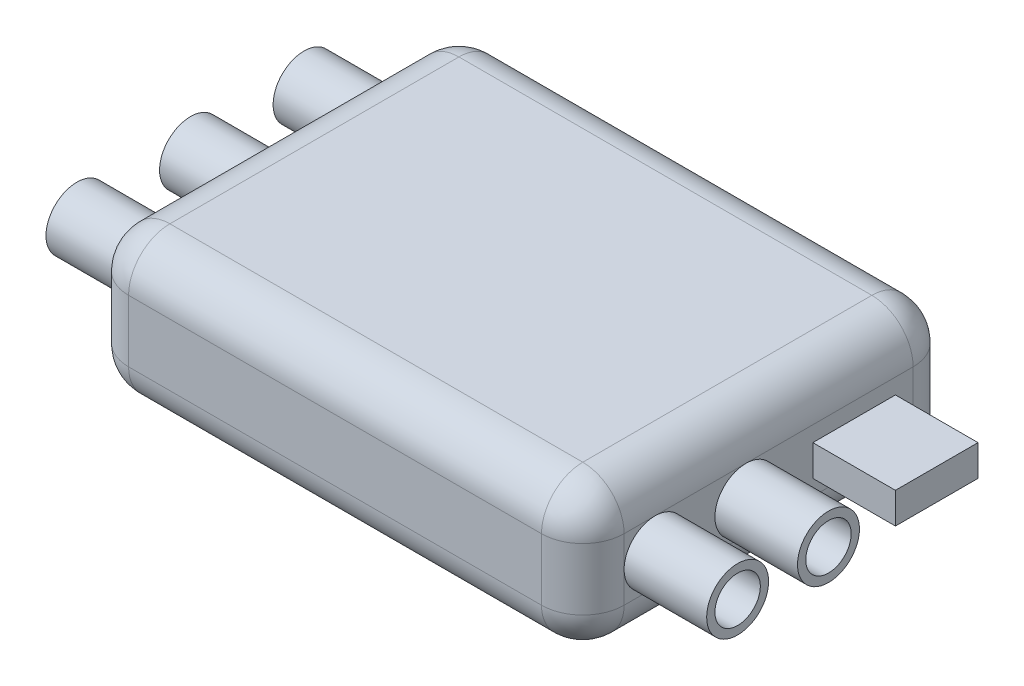
from build123d import *

# Parameters (mm, degrees)
BOSS_EXTRUDE1_DEPTH = 7
CUT_EXTRUDE3_DEPTH  = 27.570660511
SKETCH7_R           = 1.5
SKETCH7_R_2         = 1.1
BOSS_EXTRUDE3_DEPTH = 4
BOSS_EXTRUDE4_START = 4
SKETCH8_R           = 1.5
SKETCH8_R_2         = 1.1
SKETCH8_W           = 4
SKETCH8_H           = 1.5
BOSS_EXTRUDE4_DEPTH = 4
FILLET1_R           = 2


with BuildPart() as part:
    # Sketch1 → Boss-Extrude1 (new body)
    with BuildSketch(Plane(origin=(0, 0, 0), x_dir=(1, 0, 0), z_dir=(0, 1, 0))):
        with BuildLine():
            Line((10, -9), (-10, -9))
            ThreePointArc((-10, -9), (-11.414213562, -8.414213562), (-12, -7))
            Line((-12, -7), (-12, 7))
            ThreePointArc((-12, 7), (-11.414213562, 8.414213562), (-10, 9))
            Line((-10, 9), (10, 9))
            ThreePointArc((10, 9), (11.414213562, 8.414213562), (12, 7))
            Line((12, 7), (12, -7))
            ThreePointArc((12, -7), (11.414213562, -8.414213562), (10, -9))
        make_face()
    extrude(amount=-BOSS_EXTRUDE1_DEPTH)

    # Sketch5 → Cut-Extrude3 (cut, through all)
    with BuildSketch(Plane.ZY.offset(12)):
        with BuildLine():
            ThreePointArc((-7, 0), (-8.414213562, -0.585786438), (-9, -2))
            Line((-9, -2), (-9, 0))
            Line((-9, 0), (-7, 0))
        make_face()
        with BuildLine():
            ThreePointArc((-9, -5), (-8.414213562, -6.414213562), (-7, -7))
            Line((-7, -7), (-9, -7))
            Line((-9, -7), (-9, -5))
        make_face()
        with BuildLine():
            ThreePointArc((7, -7), (8.414213562, -6.414213562), (9, -5))
            Line((9, -5), (9, -7))
            Line((9, -7), (7, -7))
        make_face()
        with BuildLine():
            Line((7, 0), (9, 0))
            Line((9, 0), (9, -2))
            ThreePointArc((9, -2), (8.414213562, -0.585786438), (7, 0))
        make_face()
    extrude(amount=-CUT_EXTRUDE3_DEPTH, mode=Mode.SUBTRACT)

    # Sketch7 → Boss-Extrude3 (add)
    # profile 1 of 3: a face of its own
    with BuildSketch(Plane.ZY.offset(12)):
        with Locations(Location((-5.5, -3.5, 0), (0, 0, 180))):
            Circle(SKETCH7_R)
        with Locations((-5.5, -3.5)):
            Circle(SKETCH7_R_2, mode=Mode.SUBTRACT)
    # profile 2 of 3: a face of its own
    with BuildSketch(Plane.ZY.offset(12)):
        with Locations((0, -3.5)):
            Circle(SKETCH7_R)
        with Locations((0, -3.5)):
            Circle(SKETCH7_R_2, mode=Mode.SUBTRACT)
    # profile 3 of 3: a face of its own
    with BuildSketch(Plane.ZY.offset(12)):
        with Locations((5.5, -3.5)):
            Circle(SKETCH7_R)
        with Locations((5.5, -3.5)):
            Circle(SKETCH7_R_2, mode=Mode.SUBTRACT)
    extrude(amount=BOSS_EXTRUDE3_DEPTH)

    # Sketch8 → Boss-Extrude4 (add)
    # profile 1 of 3: a face of its own
    with BuildSketch(Plane(origin=(12, 0, 0), x_dir=(0, 0, -1), z_dir=(1, 0, 0)).offset(BOSS_EXTRUDE4_START)):
        with Locations(Location((-5.5, -3.5, 0), (0, 0, 180))):
            Circle(SKETCH8_R)
        with Locations(Location((-5.5, -3.5, 0), (0, 0, 180))):
            Circle(SKETCH8_R_2, mode=Mode.SUBTRACT)
    # profile 2 of 3: a face of its own
    with BuildSketch(Plane(origin=(12, 0, 0), x_dir=(0, 0, -1), z_dir=(1, 0, 0)).offset(BOSS_EXTRUDE4_START)):
        with Locations((-1.1, -3.5)):
            Circle(SKETCH8_R)
        with Locations((-1.1, -3.5)):
            Circle(SKETCH8_R_2, mode=Mode.SUBTRACT)
    # profile 3 of 3: a face of its own
    with BuildSketch(Plane(origin=(12, 0, 0), x_dir=(0, 0, -1), z_dir=(1, 0, 0)).offset(BOSS_EXTRUDE4_START)):
        with Locations((4.14210092, -3.5)):
            Rectangle(SKETCH8_W, SKETCH8_H)
    extrude(amount=-BOSS_EXTRUDE4_DEPTH)

    # Fillet1
    # the kernel refuses this fillet: 2 mm, written as the material it takes off along each edge
    with BuildSketch(Plane(origin=(10, -2, 7), x_dir=(1, 0, 0), z_dir=(0, 1, 0))) as fillet1_piece_1_section:
        Polygon((0, 0), (FILLET1_R, 0), (FILLET1_R, -FILLET1_R), (0, -FILLET1_R), align=None)
    fillet1_piece_1 = extrude(amount=FILLET1_R, mode=Mode.PRIVATE)
    fillet1_piece_1 = fillet1_piece_1 - Plane(origin=(10, -2, 7), x_dir=(-0.7071067811865475, 0, -0.7071067811865475), z_dir=(0, 1, 0)) * Sphere(FILLET1_R, mode=Mode.PRIVATE)
    add(fillet1_piece_1, mode=Mode.SUBTRACT)
    with BuildSketch(Plane(origin=(-10, -2, 7), x_dir=(-1, 0, 0), z_dir=(0, 1, 0))) as fillet1_piece_2_section:
        Polygon((0, 0), (FILLET1_R, 0), (FILLET1_R, FILLET1_R), (0, FILLET1_R), align=None)
    fillet1_piece_2 = extrude(amount=FILLET1_R, mode=Mode.PRIVATE)
    fillet1_piece_2 = fillet1_piece_2 - Plane(origin=(-10, -2, 7), x_dir=(0.7071067811865475, 0, -0.7071067811865475), z_dir=(0, 1, 0)) * Sphere(FILLET1_R, mode=Mode.PRIVATE)
    add(fillet1_piece_2, mode=Mode.SUBTRACT)
    with BuildSketch(Plane(origin=(10, -5, 7), x_dir=(1, 0, 0), z_dir=(0, -1, 0))) as fillet1_piece_3_section:
        Polygon((0, 0), (FILLET1_R, 0), (FILLET1_R, FILLET1_R), (0, FILLET1_R), align=None)
    fillet1_piece_3 = extrude(amount=FILLET1_R, mode=Mode.PRIVATE)
    fillet1_piece_3 = fillet1_piece_3 - Plane(origin=(10, -5, 7), x_dir=(-0.7071067811865475, 0, -0.7071067811865475), z_dir=(0, -1, 0)) * Sphere(FILLET1_R, mode=Mode.PRIVATE)
    add(fillet1_piece_3, mode=Mode.SUBTRACT)
    with BuildSketch(Plane(origin=(-10, -5, 7), x_dir=(0, -1, 0), z_dir=(-1, 0, 0))) as fillet1_piece_4_section:
        Polygon((0, 0), (FILLET1_R, 0), (FILLET1_R, FILLET1_R), (0, FILLET1_R), align=None)
    fillet1_piece_4 = extrude(amount=FILLET1_R, mode=Mode.PRIVATE)
    fillet1_piece_4 = fillet1_piece_4 - Plane(origin=(-10, -5, 7), x_dir=(0, 0.7071067811865475, -0.7071067811865475), z_dir=(-1, 0, 0)) * Sphere(FILLET1_R, mode=Mode.PRIVATE)
    add(fillet1_piece_4, mode=Mode.SUBTRACT)
    with BuildSketch(Plane(origin=(10, -5, -7), x_dir=(1, 0, 0), z_dir=(0, -1, 0))) as fillet1_piece_5_section:
        Polygon((0, 0), (FILLET1_R, 0), (FILLET1_R, -FILLET1_R), (0, -FILLET1_R), align=None)
    fillet1_piece_5 = extrude(amount=FILLET1_R, mode=Mode.PRIVATE)
    fillet1_piece_5 = fillet1_piece_5 - Plane(origin=(10, -5, -7), x_dir=(-0.7071067811865475, 0, 0.7071067811865476), z_dir=(0, -1, 0)) * Sphere(FILLET1_R, mode=Mode.PRIVATE)
    add(fillet1_piece_5, mode=Mode.SUBTRACT)
    with BuildSketch(Plane(origin=(-10, -5, -7), x_dir=(0, -1, 0), z_dir=(-1, 0, 0))) as fillet1_piece_6_section:
        Polygon((0, 0), (FILLET1_R, 0), (FILLET1_R, -FILLET1_R), (0, -FILLET1_R), align=None)
    fillet1_piece_6 = extrude(amount=FILLET1_R, mode=Mode.PRIVATE)
    fillet1_piece_6 = fillet1_piece_6 - Plane(origin=(-10, -5, -7), x_dir=(0, 0.7071067811865475, 0.7071067811865475), z_dir=(-1, 0, 0)) * Sphere(FILLET1_R, mode=Mode.PRIVATE)
    add(fillet1_piece_6, mode=Mode.SUBTRACT)
    with BuildSketch(Plane(origin=(10, -2, -7), x_dir=(1, 0, 0), z_dir=(0, 1, 0))) as fillet1_piece_7_section:
        Polygon((0, 0), (FILLET1_R, 0), (FILLET1_R, FILLET1_R), (0, FILLET1_R), align=None)
    fillet1_piece_7 = extrude(amount=FILLET1_R, mode=Mode.PRIVATE)
    fillet1_piece_7 = fillet1_piece_7 - Plane(origin=(10, -2, -7), x_dir=(-0.7071067811865475, 0, 0.7071067811865476), z_dir=(0, 1, 0)) * Sphere(FILLET1_R, mode=Mode.PRIVATE)
    add(fillet1_piece_7, mode=Mode.SUBTRACT)
    with BuildSketch(Plane(origin=(-10, -2, -7), x_dir=(-1, 0, 0), z_dir=(0, 1, 0))) as fillet1_piece_8_section:
        Polygon((0, 0), (FILLET1_R, 0), (FILLET1_R, -FILLET1_R), (0, -FILLET1_R), align=None)
    fillet1_piece_8 = extrude(amount=FILLET1_R, mode=Mode.PRIVATE)
    fillet1_piece_8 = fillet1_piece_8 - Plane(origin=(-10, -2, -7), x_dir=(0.7071067811865475, 0, 0.7071067811865475), z_dir=(0, 1, 0)) * Sphere(FILLET1_R, mode=Mode.PRIVATE)
    add(fillet1_piece_8, mode=Mode.SUBTRACT)
    with BuildSketch(Plane(origin=(-12, 0, 7), x_dir=(1, 0, 0), z_dir=(0, 0, -1)), Plane(origin=(-12, -7, 7), x_dir=(0, 1, 0), z_dir=(0, 0, -1)), Plane(origin=(12, 0, -7), x_dir=(-1, 0, 0), z_dir=(0, 0, 1))) as fillet1_piece_9:
        with BuildLine():
            CenterArc((FILLET1_R, FILLET1_R), FILLET1_R, 180, 90)
            Line((0, FILLET1_R), (0, 0))
            Line((0, 0), (FILLET1_R, 0))
        make_face()
    extrude(amount=14, mode=Mode.SUBTRACT)
    with BuildSketch(Plane(origin=(12, -7, -7), x_dir=(-1, 0, 0), z_dir=(0, 0, 1))) as fillet1_piece_10:
        with BuildLine():
            CenterArc((FILLET1_R, -FILLET1_R), FILLET1_R, 90, 90)
            Line((0, -FILLET1_R), (0, 0))
            Line((0, 0), (FILLET1_R, 0))
        make_face()
    extrude(amount=14, mode=Mode.SUBTRACT)


solid = part.part
